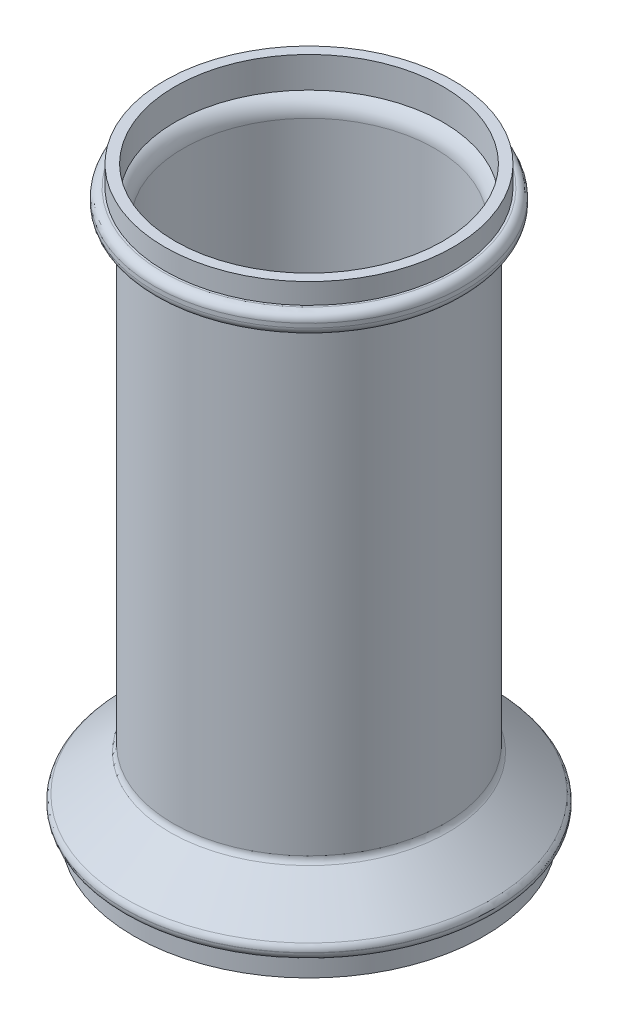
from build123d import *

# Parameters (mm, degrees)
SKETCH1_R           = 42.5
BOSS_EXTRUDE1_DEPTH = 5
SKETCH2_R           = 45
BOSS_EXTRUDE2_DEPTH = 3
SKETCH3_R           = 33
BOSS_EXTRUDE3_START = -18
SKETCH4_R           = 33
BOSS_EXTRUDE3_DEPTH = 131
SKETCH5_R           = 37.5
BOSS_EXTRUDE4_DEPTH = 5
FILLET1_R           = 2
FILLET2_R           = 2
SKETCH7_R           = 35
BOSS_EXTRUDE5_DEPTH = 5


# Read off the part's stored shape, not the designer's step: Shell1
with BuildPart() as part:
    # Sketch1 → Boss-Extrude1 (new body)
    with BuildSketch(Plane(origin=(0, 0, 0), x_dir=(1, 0, 0), z_dir=(0, 1, 0))):
        with Locations(Location((0, 0, 0), (0, 0, 270))):
            Circle(SKETCH1_R)
    extrude(amount=BOSS_EXTRUDE1_DEPTH)

    # Sketch2 → Boss-Extrude2 (add)
    with BuildSketch(Plane(origin=(0, 5, 0), x_dir=(1, 0, 0), z_dir=(0, 1, 0))):
        with Locations(Location((0, 0, 0), (0, 0, 270))):
            Circle(SKETCH2_R)
    extrude(amount=BOSS_EXTRUDE2_DEPTH)

    # Sketch3 → section 1 of loft1
    with BuildSketch(Plane(origin=(0, 18, 0), x_dir=(1, 0, 0), z_dir=(0, 1, 0)), mode=Mode.PRIVATE) as loft1_s1:
        Circle(SKETCH3_R)
    # loft from a face of the part (loft1)
    loft([part.faces().sort_by_distance((0, 8, 0))[0], loft1_s1.sketch])

    # Sketch4 → Boss-Extrude3 (add)
    with BuildSketch(Plane(origin=(0, 18, 0), x_dir=(1, 0, 0), z_dir=(0, 1, 0)).offset(BOSS_EXTRUDE3_START)):
        with Locations(Location((0, 0, 0), (0, 0, 270))):
            Circle(SKETCH4_R)
    extrude(amount=BOSS_EXTRUDE3_DEPTH)

    # Sketch5 → Boss-Extrude4 (add)
    with BuildSketch(Plane(origin=(0, 131, 0), x_dir=(1, 0, 0), z_dir=(0, 1, 0))):
        with Locations(Location((0, 0, 0), (0, 0, 270))):
            Circle(SKETCH5_R)
    extrude(amount=BOSS_EXTRUDE4_DEPTH)

    # Fillet1
    fillet1_edges = [part.edges().sort_by_distance(p)[0] for p in [
        (0, 18, -33),
        (0, 131, -33),
        (0, 5, -45),
        (0, 8, -45),
    ]]
    fillet(fillet1_edges, radius=FILLET1_R)

    # Fillet2
    fillet2_edges = [part.edges().sort_by_distance(p)[0] for p in [
        (0, 131, -37.5),
        (0, 136, -37.5),
    ]]
    fillet(fillet2_edges, radius=FILLET2_R)

    # Sketch7 → Boss-Extrude5 (add)
    with BuildSketch(Plane(origin=(0, 136, 0), x_dir=(1, 0, 0), z_dir=(0, 1, 0))):
        with Locations(Location((0, 0, 0), (0, 0, 270))):
            Circle(SKETCH7_R)
    extrude(amount=BOSS_EXTRUDE5_DEPTH)

    # Shell1 outline → Shell1 (revolve, cut)
    with BuildSketch(Plane.XY):
        with BuildLine():
            ThreePointArc((32.119170202, 15.479754134), (30.924847604, 17.028050609), (30.5, 18.936749892))
            Line((30.5, 18.936749892), (30.5, 129))
            ThreePointArc((30.5, 129), (31.818019485, 132.181980515), (35, 133.5))
            Line((35, 133.5), (32.5, 133.5))
            Line((32.5, 133.5), (32.5, 141))
            Line((32.5, 141), (0, 141))
            Line((0, 141), (0, 0))
            Line((0, 0), (40, 0))
            Line((40, 0), (40, 7.5))
            Line((40, 7.5), (41.694875162, 7.5))
            Line((41.694875162, 7.5), (32.119170202, 15.479754134))
        make_face()
    revolve(axis=Axis((0, 0, 0), (0, 1, 0)), mode=Mode.SUBTRACT)


solid = part.part
